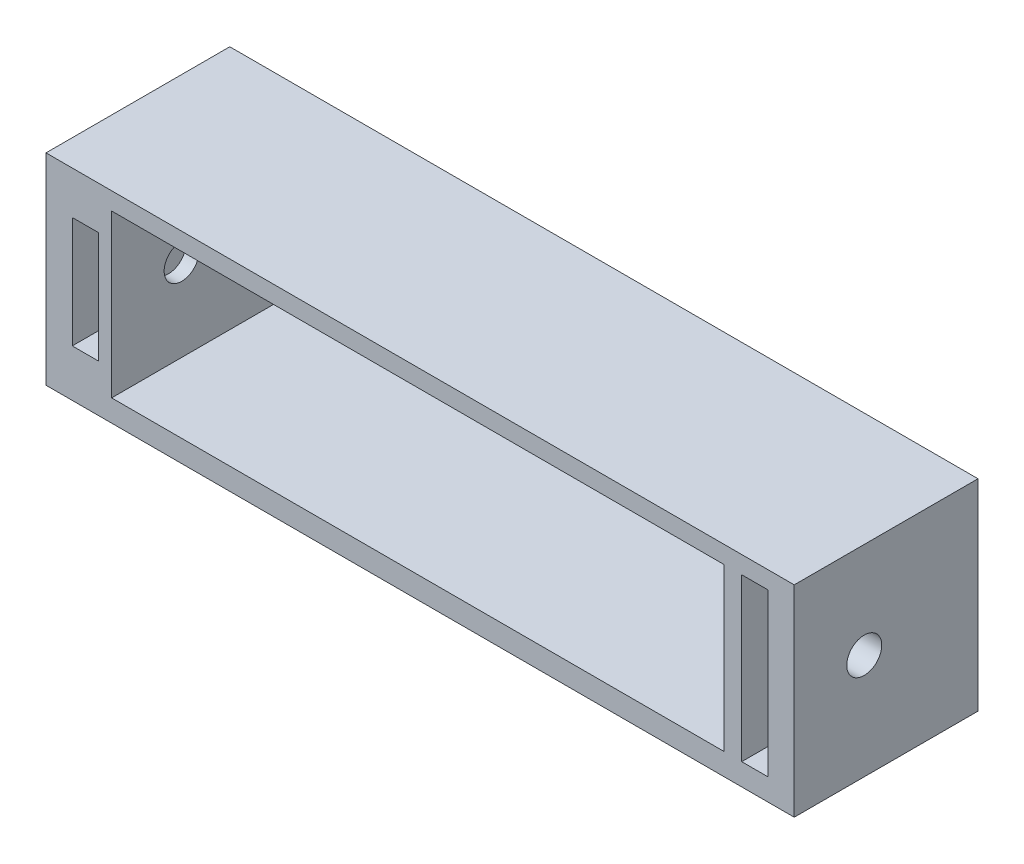
from build123d import *

# Parameters (mm, degrees)
SKETCH_1_W          = 85.5
SKETCH_1_H          = 23
SKETCH_1_W_2        = 3
SKETCH_1_H_2        = 18.5
SKETCH_1_W_3        = 70
SKETCH_1_H_3        = 12.711442786
EXTRUDE_1_DEPTH     = 19
SKETCH_2_W          = 85.5
SKETCH_2_H          = 23
EXTRUDE_2_DEPTH     = 2
SKETCH_3_R          = 2
CUT_EXTRUDE_1_DEPTH = 97
SKETCH_4_W          = 65.5
SKETCH_4_H          = 15.718049096
CUT_EXTRUDE_2_DEPTH = 10


with BuildPart() as part:
    # 草圖1 → 填料-伸長1 (new body)
    with BuildSketch(Plane.XY):
        with Locations((-2.25, -0.25)):
            Rectangle(SKETCH_1_W, SKETCH_1_H)
        with Locations((36, 0)):
            Rectangle(SKETCH_1_W_2, SKETCH_1_H_2, mode=Mode.SUBTRACT)
        with Locations((-2.5, 0)):
            Rectangle(SKETCH_1_W_3, SKETCH_1_H_2, mode=Mode.SUBTRACT)
        with Locations((-40.5, 0)):
            Rectangle(SKETCH_1_W_2, SKETCH_1_H_3, mode=Mode.SUBTRACT)
    extrude(amount=EXTRUDE_1_DEPTH)

    # 草圖2 → 填料-伸長2 (add)
    with BuildSketch(Plane(origin=(0, 0, 0), x_dir=(-1, 0, 0), z_dir=(0, 0, -1))):
        with Locations((2.25, -0.25)):
            Rectangle(SKETCH_2_W, SKETCH_2_H)
    extrude(amount=EXTRUDE_2_DEPTH)

    # 草圖3 → 除料-伸長1 (cut)
    with BuildSketch(Plane(origin=(40.5, 0, 0), x_dir=(0, 0, -1), z_dir=(1, 0, 0))):
        with Locations((-11, 0.282979523)):
            Circle(SKETCH_3_R)
    extrude(amount=-CUT_EXTRUDE_1_DEPTH, mode=Mode.SUBTRACT)

    # 草圖4 → 除料-伸長2 (cut)
    with BuildSketch(Plane(origin=(0, 0, -2), x_dir=(-1, 0, 0), z_dir=(0, 0, -1))):
        with Locations((2.25, 0)):
            Rectangle(SKETCH_4_W, SKETCH_4_H)
    extrude(amount=-CUT_EXTRUDE_2_DEPTH, mode=Mode.SUBTRACT)


solid = part.part
